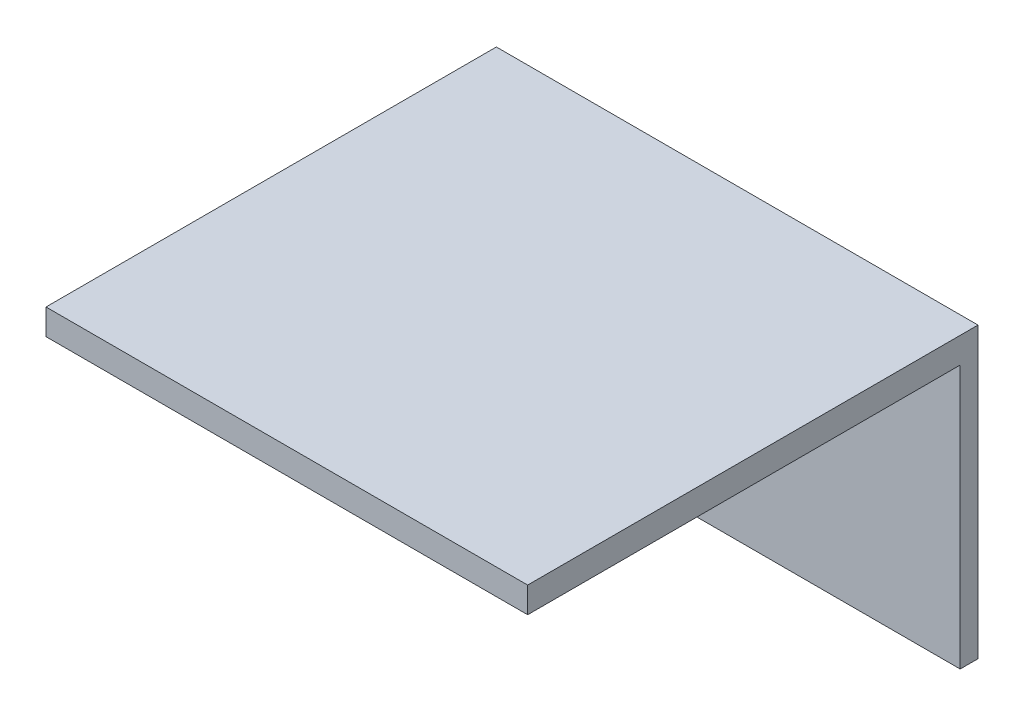
from build123d import *

# Parameters (mm, degrees)
SKIZZE1_W                       = 1000
SKIZZE1_H                       = 600
AUFSATZ_LINEAR_AUSTRAGEN1_DEPTH = 37
SKIZZE2_W                       = 1000
SKIZZE2_H                       = 53.401164718
AUFSATZ_LINEAR_AUSTRAGEN2_DEPTH = 898


with BuildPart() as part:
    # Skizze1 → Aufsatz-Linear austragen1 (new body)
    with BuildSketch(Plane.XY):
        Rectangle(SKIZZE1_W, SKIZZE1_H)
    extrude(amount=AUFSATZ_LINEAR_AUSTRAGEN1_DEPTH)

    # Skizze2 → Aufsatz-Linear austragen2 (add)
    with BuildSketch(Plane.XY.offset(37)):
        with Locations((0, 273.299417641)):
            Rectangle(SKIZZE2_W, SKIZZE2_H)
    extrude(amount=AUFSATZ_LINEAR_AUSTRAGEN2_DEPTH)


solid = part.part
